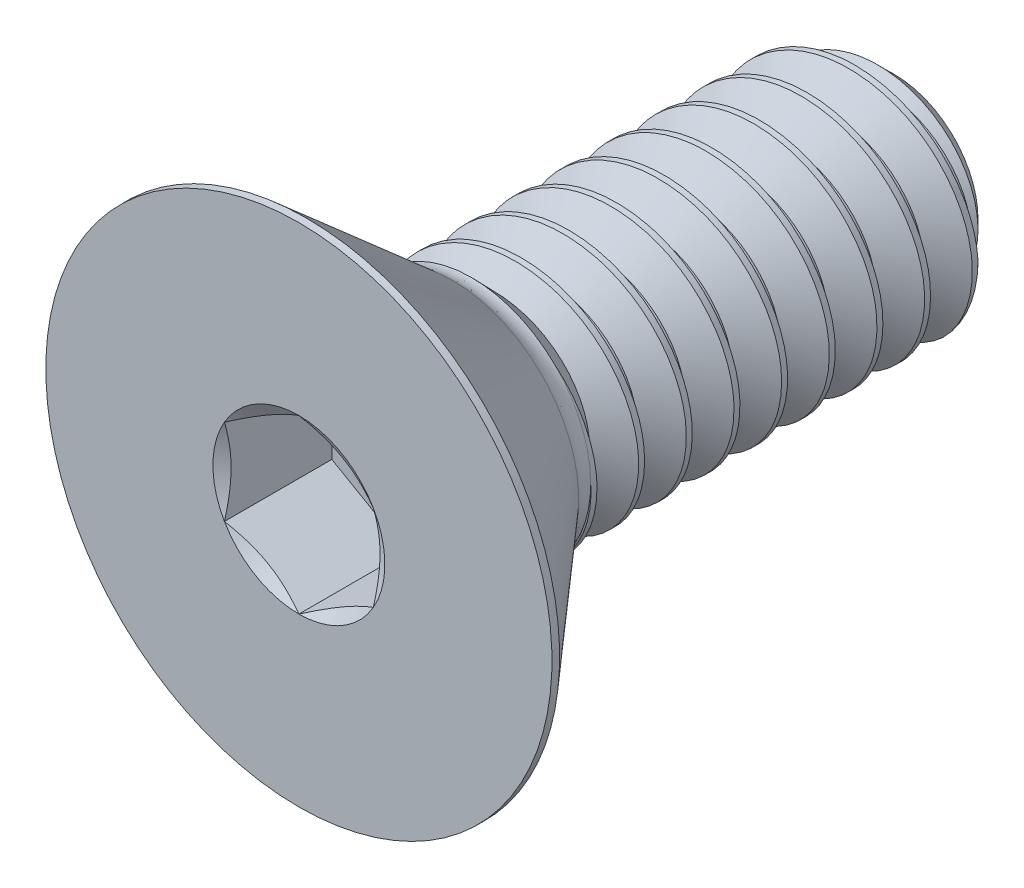
from build123d import *
from build123d.topology import SkipClean

# Parameters (mm, degrees)
SKETCH1_W          = 15.875
SKETCH1_H          = 3.175
CHAMFER1_SIZE      = 0.9525
CUT_SWEEP1_PITCH   = 1.27
CUT_EXTRUDE2_DEPTH = 2.86258


with BuildPart() as part:
    # Sketch1 → Revolve1 (revolve)
    with BuildSketch(Plane(origin=(0, 0, 0), x_dir=(0, 0, -1), z_dir=(1, 0, 0))):
        with Locations((7.9375, 1.5875)):
            Rectangle(SKETCH1_W, SKETCH1_H)
    revolve(axis=Axis((0, 0, -15.875), (0, 0, 1)))

    # Chamfer1
    chamfer1_edges = [part.edges().sort_by_distance(p)[0] for p in [
        (0, -3.175, -15.875),
    ]]
    chamfer(chamfer1_edges, length=CHAMFER1_SIZE)

    # Cut-Sweep1: the profile of Sketch2 profile screwed along a right-hand helix of 12.5 turns, 8 arcs to a turn; built about Z, then put on its axis
    with SkipClean():  # the faces are left unmerged after this step: merging them gives an invalid solid
        cut_sweep1_z = Axis((0, 0, 0), (0, 0, 1))
        cut_sweep1_corners = [(3.1756, 0, 0.00034641), (3.1756, 0, -1.11159641), (2.350110803, 0, -0.635), (2.350110803, 0, -0.47625)]
        with BuildLine(mode=Mode.PRIVATE) as cut_sweep1_profile:
            Line(cut_sweep1_corners[0], cut_sweep1_corners[1])
            Line(cut_sweep1_corners[1], cut_sweep1_corners[2])
            Line(cut_sweep1_corners[2], cut_sweep1_corners[3])
            Line(cut_sweep1_corners[3], cut_sweep1_corners[0])
        cut_sweep1_cap = Face(cut_sweep1_profile.wire())
        cut_sweep1_turn_angles = [0, 22.5, 45, 67.5, 90, 112.5, 135, 157.5, 180, 202.5, 225, 247.5, 270, 292.5, 315, 337.5, 360]
        cut_sweep1_turn_weights = [1, 0.9238795325112867, 1, 0.9238795325112867, 1, 0.9238795325112867, 1, 0.9238795325112867, 1, 0.9238795325112867, 1, 0.9238795325112867, 1, 0.9238795325112867, 1, 0.9238795325112867, 1]
        cut_sweep1_turn_rails = [Edge.make_bspline([Vector(p[0], p[1], 0).rotate(cut_sweep1_z, cut_sweep1_turn_angles[k]) / cut_sweep1_turn_weights[k] + Vector(0, 0, p[2] + CUT_SWEEP1_PITCH * cut_sweep1_turn_angles[k] / 360) for k in range(17)], [0, 0, 0, 1, 1, 2, 2, 3, 3, 4, 4, 5, 5, 6, 6, 7, 7, 8, 8, 8], 2, cut_sweep1_turn_weights) for p in cut_sweep1_corners]
        cut_sweep1_turn_sides = [Face.make_surface_from_curves(cut_sweep1_turn_rails[p[0]], cut_sweep1_turn_rails[p[1]]) for p in [(0, 1), (1, 2), (2, 3), (3, 0)]]
        cut_sweep1_last_angles = [4320, 4342.5, 4365, 4387.5, 4410, 4432.5, 4455, 4477.5, 4500]
        cut_sweep1_last_weights = [1, 0.9238795325112867, 1, 0.9238795325112867, 1, 0.9238795325112867, 1, 0.9238795325112169, 1]
        cut_sweep1_last_rails = [Edge.make_bspline([Vector(p[0], p[1], 0).rotate(cut_sweep1_z, cut_sweep1_last_angles[k]) / cut_sweep1_last_weights[k] + Vector(0, 0, p[2] + CUT_SWEEP1_PITCH * cut_sweep1_last_angles[k] / 360) for k in range(9)], [0, 0, 0, 1, 1, 2, 2, 3, 3, 4, 4, 4], 2, cut_sweep1_last_weights) for p in cut_sweep1_corners]
        cut_sweep1_last_sides = [Face.make_surface_from_curves(cut_sweep1_last_rails[p[0]], cut_sweep1_last_rails[p[1]]) for p in [(0, 1), (1, 2), (2, 3), (3, 0)]]
        cut_sweep1 = Plane(origin=(0, 0, -15.875), x_dir=(0, 1, 0), z_dir=(0, 0, 1)) * Solid(Shell([*[p.moved(Location((0, 0, CUT_SWEEP1_PITCH * i))) for i in range(12) for p in cut_sweep1_turn_sides], *cut_sweep1_last_sides, cut_sweep1_cap, cut_sweep1_cap.rotate(cut_sweep1_z, 4500).moved(Location((0, 0, CUT_SWEEP1_PITCH * 4500 / 360)))]))
        add(cut_sweep1, mode=Mode.SUBTRACT)

    # Sketch7 → Revolve2 (revolve)
    with BuildSketch(Plane(origin=(0, 0, 0), x_dir=(0, 0, -1), z_dir=(1, 0, 0)), mode=Mode.PRIVATE) as revolve2_sk:
        with BuildLine():
            Line((0, 6.7437), (0.20447, 6.7437))
            Line((0.20447, 6.7437), (4.0894, 3.366581874))
            ThreePointArc((4.0894, 3.366581874), (4.328282675, 3.224461616), (4.601808997, 3.175))
            Line((4.601808997, 3.175), (4.601808997, 0))
            Line((4.601808997, 0), (0, 0))
            Line((0, 0), (0, 6.7437))
        make_face()
    revolve(revolve2_sk.sketch.rotate(Axis((0, 0, 0), (0, 0, -1)), 189.052465709), axis=Axis((0, 0, 0), (0, 0, -1)))

    # Boss-Extrude1 cone 1 section (through the dimple's axis) → Boss-Extrude1 (revolve)
    with BuildSketch(Plane(origin=(0, 0, -4.601808997), x_dir=(0, -1, 0), z_dir=(1, 0, 0))):
        Polygon((0, 0), (3.175, 0), (0, 3.06606186), align=None)
    revolve(axis=Axis((0, 0, -4.601808997), (0, 0, -1)))

    # Sketch5 → Cut-Extrude2 (cut)
    with BuildSketch(Plane.XY):
        Polygon((0, 2.291358881), (-1.984375, 1.14567944), (-1.984375, -1.14567944), (0, -2.291358881), (1.984375, -1.14567944), (1.984375, 1.14567944), align=None)
    extrude(amount=-CUT_EXTRUDE2_DEPTH, mode=Mode.SUBTRACT)

    # Cut-Extrude3 cone 1 section (through the dimple's axis) → Cut-Extrude3 (revolve, cut)
    with BuildSketch(Plane(origin=(0, 0, 0), x_dir=(0, -1, 0), z_dir=(1, 0, 0))):
        Polygon((0, 0), (2.291358881, 0), (0, 1.322916667), align=None)
    revolve(axis=Axis((0, 0, 0), (0, 0, -1)), mode=Mode.SUBTRACT)


solid = part.part
